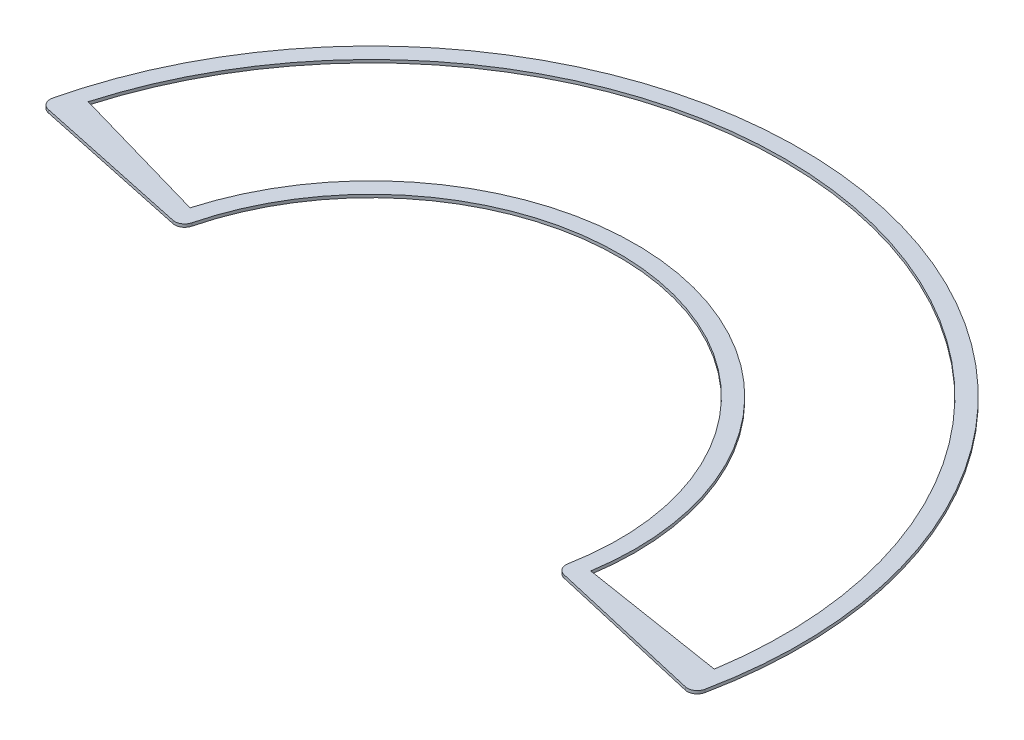
from build123d import *

# Parameters (mm, degrees)
BASE_FLANGE1_DEPTH = 0.9


# Sheet-metal steps are written as plain solids
with BuildPart() as part:
    # Sketch1 → Base-Flange1 (new body)
    with BuildSketch(Plane(origin=(0, 0, 0), x_dir=(1, 0, 0), z_dir=(0, 1, 0))):
        with BuildLine():
            Line((-76.23906038, 16.205112539), (-124.190081684, 26.397416756))
            ThreePointArc((-124.190081684, 26.397416756), (-126.101482372, 27.727775186), (-126.485236689, 30.024738131))
            ThreePointArc((-126.485236689, 30.024738131), (28.137149812, 126.918480926), (127.323557594, -26.243316894))
            ThreePointArc((127.323557594, -26.243316894), (126.005019582, -28.162890715), (123.710468487, -28.560812083))
            Line((123.710468487, -28.560812083), (75.944630591, -17.53319949))
            ThreePointArc((75.944630591, -17.53319949), (74.106388046, -16.248487893), (73.672580533, -14.048162785))
            ThreePointArc((73.672580533, -14.048162785), (16.232971045, 73.222200534), (-72.707043565, 18.403418598))
            ThreePointArc((-72.707043565, 18.403418598), (-74.030104265, 16.592581795), (-76.23906038, 16.205112539))
        make_face()
        with BuildLine():
            Line((-76.900935675, 22.050988465), (-120.157711992, 34.454669477))
            ThreePointArc((-120.157711992, 34.454669477), (27.054951742, 122.03700089), (123.461042574, -19.55430813))
            Line((123.461042574, -19.55430813), (79.015067248, -12.514757203))
            ThreePointArc((79.015067248, -12.514757203), (17.315169115, 78.10368057), (-76.900935675, 22.050988465))
        make_face(mode=Mode.SUBTRACT)
    extrude(amount=-BASE_FLANGE1_DEPTH)


solid = part.part
